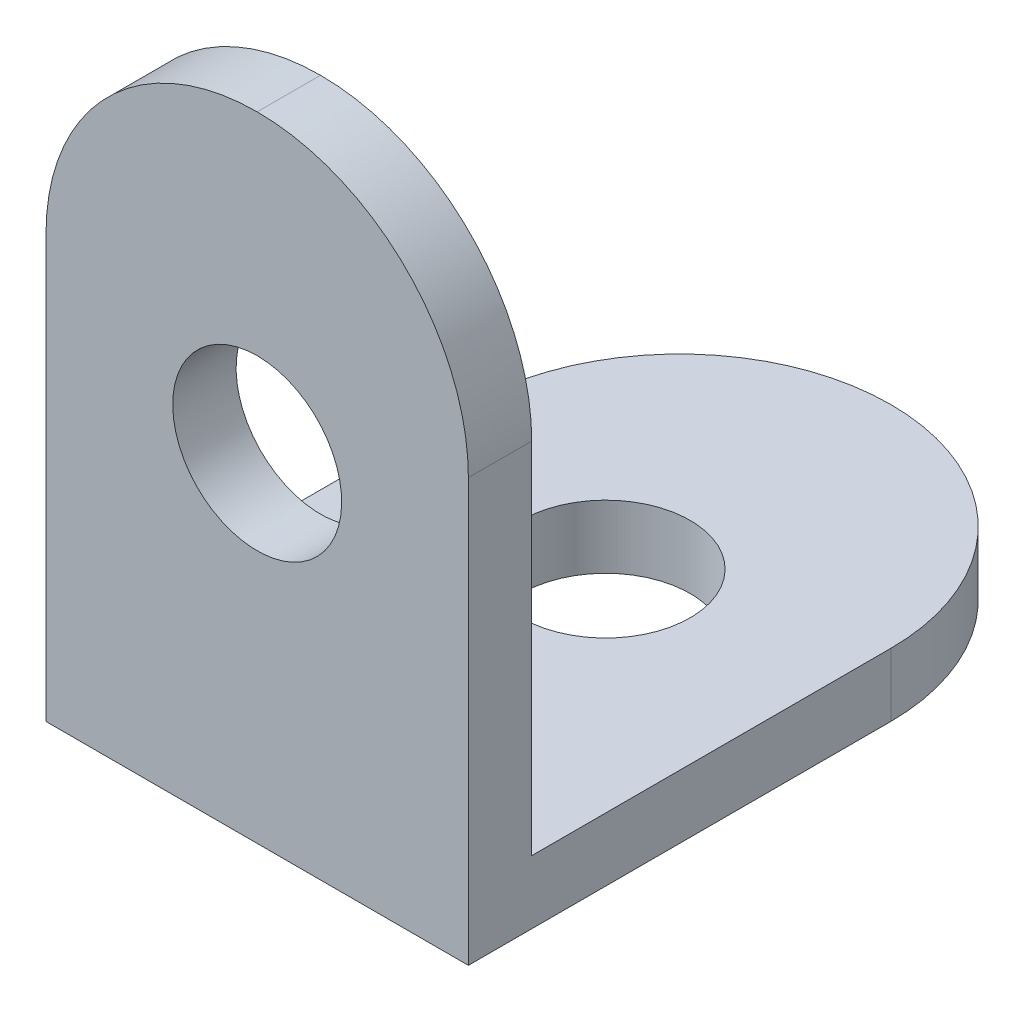
from build123d import *

# Parameters (mm, degrees)
BOSS_EXTRU_1_DEPTH      = 10
ESQUISSE2_R             = 2
ENL_V_MAT_EXTRU_1_DEPTH = 22.552262062
CONG_1_R                = 5
ESQUISSE3_R             = 2
ENL_V_MAT_EXTRU_2_DEPTH = 19.716636984
CONG_2_R                = 5


with BuildPart() as part:
    # Esquisse1 → Boss.-Extru.1 (new body)
    with BuildSketch(Plane(origin=(0, 0, 0), x_dir=(0, 0, -1), z_dir=(1, 0, 0))):
        Polygon((6.75, 0), (-6.75, 0), (-6.75, 13.5), (-8.25, 13.5), (-8.25, -1.5), (6.75, -1.5), align=None)
    extrude(amount=BOSS_EXTRU_1_DEPTH)

    # Esquisse2 → Enlèv. mat.-Extru.1 (cut, through all)
    with BuildSketch(Plane(origin=(0, 0, 6.75), x_dir=(-1, 0, 0), z_dir=(0, 0, -1))):
        with Locations(Location((-5, 6.5, 0), (0, 0, 90))):
            Circle(ESQUISSE2_R)
    extrude(amount=-ENL_V_MAT_EXTRU_1_DEPTH, mode=Mode.SUBTRACT)

    # Congé1
    cong_1_edges = [part.edges().sort_by_distance(p)[0] for p in [
        (0, 13.5, 7.5),
        (10, 13.5, 7.5),
    ]]
    fillet(cong_1_edges, radius=CONG_1_R - 0.0001)  # a hair under: the kernel refuses the full size

    # Esquisse3 → Enlèv. mat.-Extru.2 (cut, through all)
    with BuildSketch(Plane(origin=(0, 0, 0), x_dir=(1, 0, 0), z_dir=(0, 1, 0))):
        with Locations(Location((5, 0, 0), (0, 0, 270))):
            Circle(ESQUISSE3_R)
    extrude(amount=-ENL_V_MAT_EXTRU_2_DEPTH, mode=Mode.SUBTRACT)

    # Congé2
    cong_2_edges = [part.edges().sort_by_distance(p)[0] for p in [
        (10, -0.75, -6.75),
        (0, -0.75, -6.75),
    ]]
    fillet(cong_2_edges, radius=CONG_2_R - 0.0001)  # a hair under: the kernel refuses the full size


solid = part.part
